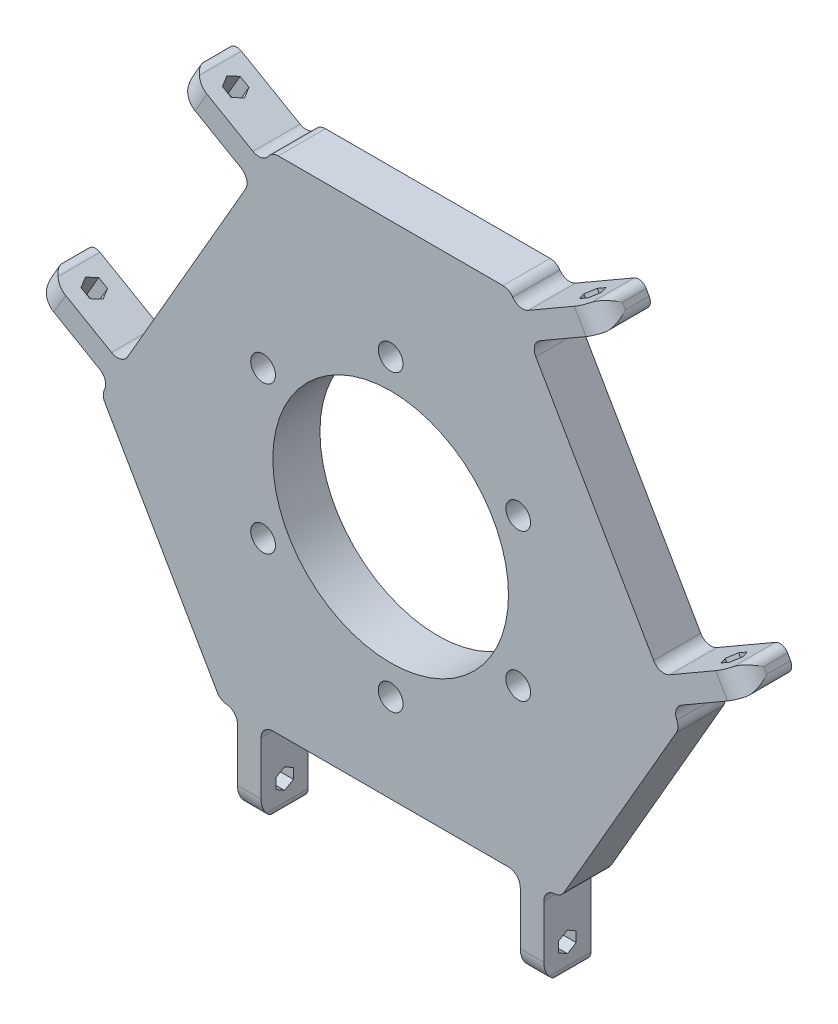
from build123d import *

# Parameters (mm, degrees)
SKETCH1_R                = 20
BOSS_EXTRUDE1_DEPTH      = 8
BOSS_EXTRUDE3_START      = 22
BOSS_EXTRUDE3_DEPTH      = 4
CIRPATTERN1_COUNT        = 3
CIRPATTERN1_START        = 22
CIRPATTERN1_COPY_1_DEPTH = 4
CIRPATTERN1_COPY_2_DEPTH = 4
SKETCH4_R                = 2.1
CUT_EXTRUDE1_DEPTH       = 83.250631167
CIRPATTERN2_COUNT        = 6
FILLET2_R                = 2
FILLET4_R                = 1.5
FILLET5_R                = 2


with BuildPart() as part:
    # Sketch1 → Boss-Extrude1 (new body)
    with BuildSketch(Plane.XY):
        Polygon((49.074772881, -5), (20.207259422, 45), (-20.207259422, 45), (-49.074772881, -5), (-28.867513459, -40), (28.867513459, -40), align=None)
        Circle(SKETCH1_R, mode=Mode.SUBTRACT)
    extrude(amount=BOSS_EXTRUDE1_DEPTH)

    # Sketch3 → Boss-Extrude3 (add)
    with BuildSketch(Plane(origin=(0, 0, 0), x_dir=(0, 0, -1), z_dir=(1, 0, 0)).offset(BOSS_EXTRUDE3_START)):
        with BuildLine():
            Line((0, -40), (0, -55))
            Line((0, -55), (-4, -55))
            ThreePointArc((-4, -55), (-6.828427125, -53.828427125), (-8, -51))
            Line((-8, -51), (-8, -40))
            Line((-8, -40), (0, -40))
        make_face()
        Polygon((-4, -48.267949192), (-5.5, -49.133974596), (-5.5, -50.866025404), (-4, -51.732050808), (-2.5, -50.866025404), (-2.5, -49.133974596), align=None, mode=Mode.SUBTRACT)
    boss_extrude3 = extrude(amount=BOSS_EXTRUDE3_DEPTH)

    # Mirror1: Boss-Extrude3 across plane
    add(boss_extrude3.mirror(Plane(origin=(0, 0, 0), x_dir=(0, 0, 1), z_dir=(1, 0, 0))))

    # CirPattern1: Boss-Extrude3 ×3 about axis
    cirpattern1_axis = Axis((0, 0, 0), (0, 0, 1))
    for i in range(1, CIRPATTERN1_COUNT):
        add(boss_extrude3.rotate(cirpattern1_axis, i * 360 / CIRPATTERN1_COUNT))

    # CirPattern1 copy 1 sketch → CirPattern1 copy 1 (add)
    with BuildSketch(Plane(origin=(0, 0, 0), x_dir=(0, 0, -1), z_dir=(0.4999999999999998, -0.8660254037844387, 0)).offset(CIRPATTERN1_START)):
        with BuildLine():
            Line((0, 40), (0, 55))
            Line((0, 55), (-4, 55))
            ThreePointArc((-4, 55), (-6.828427125, 53.828427125), (-8, 51))
            Line((-8, 51), (-8, 40))
            Line((-8, 40), (0, 40))
        make_face()
        Polygon((-4, 48.267949192), (-5.5, 49.133974596), (-5.5, 50.866025404), (-4, 51.732050808), (-2.5, 50.866025404), (-2.5, 49.133974596), align=None, mode=Mode.SUBTRACT)
    extrude(amount=CIRPATTERN1_COPY_1_DEPTH)

    # CirPattern1 copy 2 sketch → CirPattern1 copy 2 (add)
    with BuildSketch(Plane(origin=(0, 0, 0), x_dir=(0, 0, -1), z_dir=(0.5000000000000004, 0.8660254037844384, 0)).offset(CIRPATTERN1_START)):
        with BuildLine():
            Line((0, 40), (0, 55))
            Line((0, 55), (-4, 55))
            ThreePointArc((-4, 55), (-6.828427125, 53.828427125), (-8, 51))
            Line((-8, 51), (-8, 40))
            Line((-8, 40), (0, 40))
        make_face()
        Polygon((-4, 48.267949192), (-5.5, 49.133974596), (-5.5, 50.866025404), (-4, 51.732050808), (-2.5, 50.866025404), (-2.5, 49.133974596), align=None, mode=Mode.SUBTRACT)
    extrude(amount=CIRPATTERN1_COPY_2_DEPTH)

    # Sketch4 → Cut-Extrude1 (cut, through all)
    with BuildSketch(Plane.XY.offset(8)):
        with Locations((0, 25)):
            Circle(SKETCH4_R)
    cut_extrude1 = extrude(amount=-CUT_EXTRUDE1_DEPTH, mode=Mode.SUBTRACT)

    # CirPattern2: Cut-Extrude1 ×6 about axis
    cirpattern2_axis = Axis((0, 0, 0), (0, 0, 1))
    for i in range(1, CIRPATTERN2_COUNT):
        add(cut_extrude1.rotate(cirpattern2_axis, i * 360 / CIRPATTERN2_COUNT), mode=Mode.SUBTRACT)

    # Fillet2
    fillet2_edges = [part.edges().sort_by_distance(p)[0] for p in [
        (-26, -40, 4),
        (-22, -40, 4),
        (26, -40, 4),
        (22, -40, 4),
        (-47.641016151, -2.516660498, 4),
        (-23.641016151, 39.052558883, 4),
        (-45.641016151, 0.947441117, 4),
        (-21.641016151, 42.516660498, 4),
        (23.641016151, 39.052558883, 4),
        (21.641016151, 42.516660498, 4),
        (45.641016151, 0.947441117, 4),
        (47.641016151, -2.516660498, 4),
    ]]
    fillet(fillet2_edges, radius=FILLET2_R)

    # Fillet4
    # the kernel refuses this fillet: 1.5 mm, written as the material it takes off along each edge
    with BuildSketch(Plane(origin=(36.631397208, 46.552558883, -3.75), x_dir=(-0.8660254037844387, -0.5, -1.7763568394002503e-15), z_dir=(0, 0, 1)), Plane(origin=(34.631397208, 50.016660498, -3.75), x_dir=(0.5, -0.8660254037844387, 0), z_dir=(0, 0, 1)), Plane(origin=(58.631397208, 8.447441117, -3.75), x_dir=(0.4999999999999998, -0.8660254037844389, 0), z_dir=(0, 0, 1)), Plane(origin=(60.631397208, 4.983339502, -3.75), x_dir=(-0.866025403784439, -0.4999999999999993, -1.7763568394002505e-15), z_dir=(0, 0, 1)), Plane(origin=(-36.631397208, 46.552558883, -3.75), x_dir=(0.5, 0.8660254037844387, 0), z_dir=(0, 0, 1)), Plane(origin=(-34.631397208, 50.016660498, -3.75), x_dir=(0.8660254037844398, -0.49999999999999795, -1.7763568394002505e-15), z_dir=(0, 0, 1))) as fillet4_piece_1:
        with BuildLine():
            CenterArc((FILLET4_R, -FILLET4_R), FILLET4_R, 90, 90)
            Line((0, -FILLET4_R), (0, 0))
            Line((0, 0), (FILLET4_R, 0))
        make_face()
    extrude(amount=11.5, mode=Mode.SUBTRACT)
    with BuildSketch(Plane(origin=(-60.631397208, 4.983339502, -3.75), x_dir=(0.8660254037844379, -0.5000000000000011, -1.7763568394002503e-15), z_dir=(0, 0, 1)), Plane(origin=(-58.631397208, 8.447441117, -3.75), x_dir=(-0.5, -0.8660254037844387, 0), z_dir=(0, 0, 1)), Plane(origin=(26, -55, -3.75), x_dir=(0, 1, 0), z_dir=(0, 0, 1)), Plane(origin=(22, -55, -3.75), x_dir=(1, 0, 0), z_dir=(0, 0, 1)), Plane(origin=(-26, -55, -3.75), x_dir=(1, 0, 0), z_dir=(0, 0, 1)), Plane(origin=(-22, -55, -3.75), x_dir=(0, 1, 0), z_dir=(0, 0, 1))) as fillet4_piece_2:
        with BuildLine():
            CenterArc((FILLET4_R, FILLET4_R), FILLET4_R, 180, 90)
            Line((0, FILLET4_R), (0, 0))
            Line((0, 0), (FILLET4_R, 0))
        make_face()
    extrude(amount=11.5, mode=Mode.SUBTRACT)

    # Fillet5
    fillet5_edges = [part.edges().sort_by_distance(p)[0] for p in [
        (20.207259422, 45, 4),
        (-20.207259422, 45, 4),
        (-49.074772881, -5, 4),
        (-28.867513459, -40, 4),
        (49.074772881, -5, 4),
        (28.867513459, -40, 4),
    ]]
    fillet(fillet5_edges, radius=FILLET5_R)


solid = part.part
